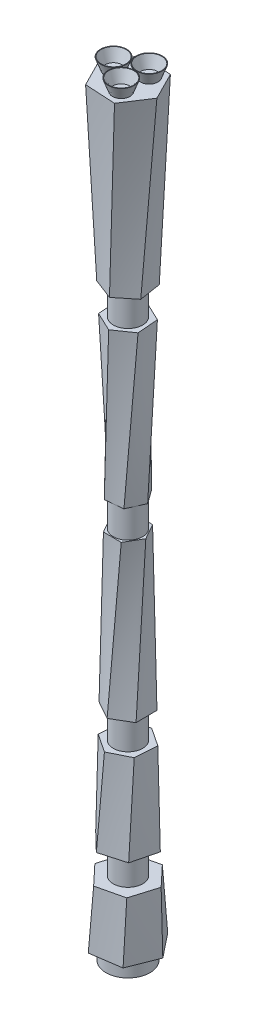
from build123d import *

# Parameters (mm, degrees)
SKETCH_4_R                = 218.726345174
SKETCH_4_R_2              = 50
CUT_EXTRUDE_1_DEPTH       = 50
SKETCH_5_R                = 285.562029702
SKETCH_5_R_2              = 50
CUT_EXTRUDE_3_DEPTH       = 50
SKETCH_6_R                = 298.266139508
SKETCH_6_R_2              = 50
CUT_EXTRUDE_4_DEPTH       = 50
SKETCH_7_R                = 171.352454247
SKETCH_7_R_2              = 50
CUT_EXTRUDE_5_DEPTH       = 50
SKETCH_8_R                = 235.914084334
CUT_EXTRUDE_6_DEPTH       = 300
SKETCH_9_R                = 225.234399524
SKETCH_9_R_2              = 75
CUT_EXTRUDE_7_DEPTH       = 50
SKETCH_10_R               = 282.4002628
CUT_EXTRUDE_8_DEPTH       = 200
SKETCH_11_R               = 30
EXTRUDE_1_DEPTH           = 40
EXTRUDE_1_DRAFT           = -20
EXTRUDE_1_PROFILE_2_DEPTH = 40
EXTRUDE_1_PROFILE_2_DRAFT = -20
EXTRUDE_1_PROFILE_3_DEPTH = 40
EXTRUDE_1_PROFILE_3_DRAFT = -20
SHELL_1_T                 = -2
SHELL_2_T                 = -2
SHELL_3_T                 = -2


with BuildPart() as part:
    # 放样1: read off the stored shape, not the designer's step
    # 放样1: loft between two sections, ruled curve by curve
    loft_1_from = [
        Edge.make_bspline([(-65.5892823, -1475, -95.033569757), (-73.840423045, -1475, -77.647108162), (-82.091563791, -1475, -60.260646568), (-98.593845281, -1475, -25.487723379), (-106.844986026, -1475, -8.101261785), (-115.096126772, -1475, 9.28519981)], [0, 0, 0, 0, 0.5, 0.5, 1, 1, 1, 1], 3),
        Edge.make_bspline([(-115.096126772, -1475, 9.28519981), (-104.164579722, -1475, 25.124128103), (-93.233032672, -1475, 40.963056395), (-71.369938571, -1475, 72.640912981), (-60.438391521, -1475, 88.479841274), (-49.506844471, -1475, 104.318769566)], [0, 0, 0, 0, 0.5, 0.5, 1, 1, 1, 1], 3),
        Edge.make_bspline([(49.506844471, -1475, -104.318769566), (30.324156676, -1475, -102.771236265), (11.141468881, -1475, -101.223702963), (-27.22390671, -1475, -98.12863636), (-46.406594505, -1475, -96.581103058), (-65.5892823, -1475, -95.033569757)], [0, 0, 0, 0, 0.5, 0.5, 1, 1, 1, 1], 3),
        Edge.make_bspline([(-49.506844471, -1475, 104.318769566), (-30.324156676, -1475, 102.771236265), (-11.141468881, -1475, 101.223702963), (27.22390671, -1475, 98.12863636), (46.406594505, -1475, 96.581103058), (65.5892823, -1475, 95.033569757)], [0, 0, 0, 0, 0.5, 0.5, 1, 1, 1, 1], 3),
        Edge.make_bspline([(65.5892823, -1475, 95.033569757), (73.840423045, -1475, 77.647108162), (82.091563791, -1475, 60.260646568), (98.593845281, -1475, 25.487723379), (106.844986026, -1475, 8.101261785), (115.096126772, -1475, -9.28519981)], [0, 0, 0, 0, 0.5, 0.5, 1, 1, 1, 1], 3),
        Edge.make_bspline([(115.096126772, -1475, -9.28519981), (104.164579722, -1475, -25.124128103), (93.233032672, -1475, -40.963056395), (71.369938571, -1475, -72.640912981), (60.438391521, -1475, -88.479841274), (49.506844471, -1475, -104.318769566)], [0, 0, 0, 0, 0.5, 0.5, 1, 1, 1, 1], 3),
    ]
    loft_1_to = [
        Edge.make_bspline([(-56.528056255, 1475, 100.687199729), (-37.284439434, 1475, 100.455721876), (-18.040822612, 1475, 100.224244022), (20.446411031, 1475, 99.761288315), (39.690027852, 1475, 99.529810462), (58.933644674, 1475, 99.298332608)], [0, 0, 0, 0, 0.5, 0.5, 1, 1, 1, 1], 3),
        Edge.make_bspline([(58.933644674, 1475, 99.298332608), (68.354987383, 1475, 82.517132653), (77.776330092, 1475, 65.735932699), (96.619015511, 1475, 32.173532789), (106.04035822, 1475, 15.392332834), (115.461700929, 1475, -1.388867121)], [0, 0, 0, 0, 0.5, 0.5, 1, 1, 1, 1], 3),
        Edge.make_bspline([(-115.461700929, 1475, 1.388867121), (-105.639426817, 1475, 17.938589222), (-95.817152705, 1475, 34.488311324), (-76.17260448, 1475, 67.587755526), (-66.350330368, 1475, 84.137477628), (-56.528056255, 1475, 100.687199729)], [0, 0, 0, 0, 0.5, 0.5, 1, 1, 1, 1], 3),
        Edge.make_bspline([(115.461700929, 1475, -1.388867121), (105.639426817, 1475, -17.938589222), (95.817152705, 1475, -34.488311324), (76.17260448, 1475, -67.587755526), (66.350330368, 1475, -84.137477628), (56.528056255, 1475, -100.687199729)], [0, 0, 0, 0, 0.5, 0.5, 1, 1, 1, 1], 3),
        Edge.make_bspline([(56.528056255, 1475, -100.687199729), (37.284439434, 1475, -100.455721876), (18.040822612, 1475, -100.224244022), (-20.446411031, 1475, -99.761288315), (-39.690027852, 1475, -99.529810462), (-58.933644674, 1475, -99.298332608)], [0, 0, 0, 0, 0.5, 0.5, 1, 1, 1, 1], 3),
        Edge.make_bspline([(-58.933644674, 1475, -99.298332608), (-68.354987383, 1475, -82.517132653), (-77.776330092, 1475, -65.735932699), (-96.619015511, 1475, -32.173532789), (-106.04035822, 1475, -15.392332834), (-115.461700929, 1475, 1.388867121)], [0, 0, 0, 0, 0.5, 0.5, 1, 1, 1, 1], 3),
    ]
    loft_1 = Solid(Shell([*[Face.make_surface_from_curves(loft_1_from[k], loft_1_to[k]) for k in range(6)], Face(Wire(loft_1_from)), Face(Wire(loft_1_to))]))
    add(loft_1)

    # 草图4 → 切除-拉伸1 (cut, symmetric)
    with BuildSketch(Plane(origin=(0, 0, 0), x_dir=(1, 0, 0), z_dir=(0, 1, 0))):
        Circle(SKETCH_4_R)
        with Locations(Location((0, 0, 0), (0, 0, 270))):
            Circle(SKETCH_4_R_2, mode=Mode.SUBTRACT)
    extrude(amount=CUT_EXTRUDE_1_DEPTH, both=True, mode=Mode.SUBTRACT)

    # 草图5 → 切除-拉伸3 (cut, symmetric)
    with BuildSketch(Plane(origin=(0, 625, 0), x_dir=(-1, 0, 0), z_dir=(0, 1, 0))):
        Circle(SKETCH_5_R)
        with Locations(Location((0, 0, 0), (0, 0, 90))):
            Circle(SKETCH_5_R_2, mode=Mode.SUBTRACT)
    extrude(amount=CUT_EXTRUDE_3_DEPTH, both=True, mode=Mode.SUBTRACT)

    # 草图6 → 切除-拉伸4 (cut, symmetric)
    with BuildSketch(Plane(origin=(0, -625, 0), x_dir=(-1, 0, 0), z_dir=(0, 1, 0))):
        Circle(SKETCH_6_R)
        with Locations(Location((0, 0, 0), (0, 0, 90))):
            Circle(SKETCH_6_R_2, mode=Mode.SUBTRACT)
    extrude(amount=CUT_EXTRUDE_4_DEPTH, both=True, mode=Mode.SUBTRACT)

    # 草图7 → 切除-拉伸5 (cut, symmetric)
    with BuildSketch(Plane(origin=(0, -1025, 0), x_dir=(-1, 0, 0), z_dir=(0, 1, 0))):
        Circle(SKETCH_7_R)
        with Locations(Location((0, 0, 0), (0, 0, 90))):
            Circle(SKETCH_7_R_2, mode=Mode.SUBTRACT)
    extrude(amount=CUT_EXTRUDE_5_DEPTH, both=True, mode=Mode.SUBTRACT)

    # 草图8 → 切除-拉伸6 (cut)
    with BuildSketch(Plane(origin=(0, -1325, 0), x_dir=(-1, 0, 0), z_dir=(0, 1, 0))):
        Circle(SKETCH_8_R)
    extrude(amount=-CUT_EXTRUDE_6_DEPTH, mode=Mode.SUBTRACT)

    # 草图9 → 切除-拉伸7 (cut)
    with BuildSketch(Plane(origin=(0, -1325, 0), x_dir=(-1, 0, 0), z_dir=(0, 1, 0))):
        Circle(SKETCH_9_R)
        with Locations(Location((0, 0, 0), (0, 0, 90))):
            Circle(SKETCH_9_R_2, mode=Mode.SUBTRACT)
    extrude(amount=CUT_EXTRUDE_7_DEPTH, mode=Mode.SUBTRACT)

    # 草图10 → 切除-拉伸8 (cut)
    with BuildSketch(Plane(origin=(0, 1475, 0), x_dir=(1, 0, 0), z_dir=(0, 1, 0))):
        Circle(SKETCH_10_R)
    extrude(amount=-CUT_EXTRUDE_8_DEPTH, mode=Mode.SUBTRACT)


with BuildPart() as body_2:
    # 草图11 → 凸台-拉伸1 (with draft: the straight prism first)
    with BuildSketch(Plane(origin=(0, 1275, 0), x_dir=(1, 0, 0), z_dir=(0, 1, 0))):
        with Locations((28.571188333, 43.708997509)):
            Circle(SKETCH_11_R)
    extrude(amount=EXTRUDE_1_DEPTH)
    # 凸台-拉伸1: the draft: its side faces are tilted about the plane it starts from
    extrude_1_sides = [body_2.faces().sort_by_distance(p)[0] for p in [
        (-1.428811667, 1295, -43.708997509),
    ]]
    draft(extrude_1_sides, Plane(origin=(0, 1275, 0), x_dir=(1, 0, 0), z_dir=(0, 1, 0)), EXTRUDE_1_DRAFT)

    # 抽壳1
    shell_1_openings = [body_2.faces().sort_by_distance(p)[0] for p in [
        (28.571188333, 1315, -43.708997509),
    ]]
    offset(amount=SHELL_1_T, openings=shell_1_openings, kind=Kind.INTERSECTION)


with BuildPart() as body_3:
    # 草图11 → 凸台-拉伸1 profile 2 (with draft: the straight prism first)
    with BuildSketch(Plane(origin=(0, 1275, 0), x_dir=(1, 0, 0), z_dir=(0, 1, 0))):
        with Locations((23.567508051, -46.597873667)):
            Circle(SKETCH_11_R)
    extrude(amount=EXTRUDE_1_PROFILE_2_DEPTH)
    # 凸台-拉伸1 profile 2: the draft: its side faces are tilted about the plane it starts from
    extrude_1_profile_2_sides = [body_3.faces().sort_by_distance(p)[0] for p in [
        (-6.432491949, 1295, 46.597873667),
    ]]
    draft(extrude_1_profile_2_sides, Plane(origin=(0, 1275, 0), x_dir=(1, 0, 0), z_dir=(0, 1, 0)), EXTRUDE_1_PROFILE_2_DRAFT)

    # 抽壳3
    shell_3_openings = [body_3.faces().sort_by_distance(p)[0] for p in [
        (23.567508051, 1315, 46.597873667),
    ]]
    offset(amount=SHELL_3_T, openings=shell_3_openings, kind=Kind.INTERSECTION)


with BuildPart() as body_4:
    # 草图11 → 凸台-拉伸1 profile 3 (with draft: the straight prism first)
    with BuildSketch(Plane(origin=(0, 1275, 0), x_dir=(1, 0, 0), z_dir=(0, 1, 0))):
        with Locations((-52.138696383, 2.888876158)):
            Circle(SKETCH_11_R)
    extrude(amount=EXTRUDE_1_PROFILE_3_DEPTH)
    # 凸台-拉伸1 profile 3: the draft: its side faces are tilted about the plane it starts from
    extrude_1_profile_3_sides = [body_4.faces().sort_by_distance(p)[0] for p in [
        (-82.138696383, 1295, -2.888876158),
    ]]
    draft(extrude_1_profile_3_sides, Plane(origin=(0, 1275, 0), x_dir=(1, 0, 0), z_dir=(0, 1, 0)), EXTRUDE_1_PROFILE_3_DRAFT)

    # 抽壳2
    shell_2_openings = [body_4.faces().sort_by_distance(p)[0] for p in [
        (-52.138696383, 1315, -2.888876158),
    ]]
    offset(amount=SHELL_2_T, openings=shell_2_openings, kind=Kind.INTERSECTION)


solid = Compound([part.part, body_2.part, body_3.part, body_4.part])
